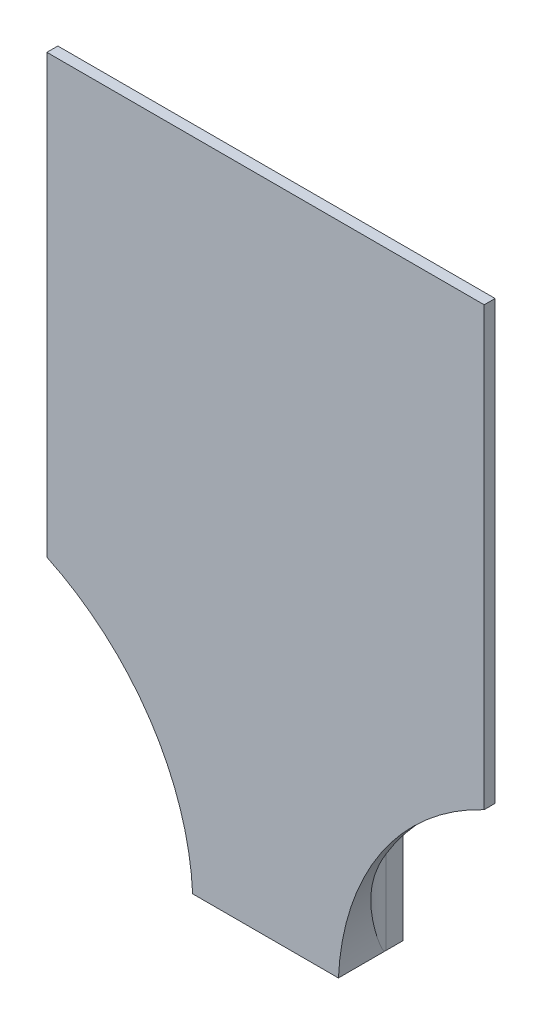
from build123d import *

# Parameters (mm, degrees)
SZKIC1_W                    = 40
SZKIC1_H                    = 20
DODANIE_WYCI_GNI_CIE1_DEPTH = 60
DODANIE_WYCI_GNI_CIE2_DEPTH = 120
DODANIE_WYCI_GNI_CIE3_DEPTH = 3
SZKIC4_W                    = 40
SZKIC4_H                    = 17
DODANIE_WYCI_GNI_CIE4_DEPTH = 120
WYTNIJ_WYCI_GNI_CIE1_DEPTH  = 40
SZKIC6_W                    = 34
SZKIC6_H                    = 170
WYTNIJ_WYCI_GNI_CIE2_DEPTH  = 17
ZAOKR_GLENIE1_R             = 10
SZKIC7_R                    = 2
WYTNIJ_WYCI_GNI_CIE3_DEPTH  = 10
SZKIC8_R                    = 5.5
WYTNIJ_WYCI_GNI_CIE4_DEPTH  = 6
ZAOKR_GLENIE2_R             = 2
WYTNIJ_WYCI_GNI_CIE5_DEPTH  = 191.000000132


with BuildPart() as part:
    # Szkic1 → Dodanie-wyciągnięcie1 (new body)
    with BuildSketch(Plane(origin=(0, 0, 0), x_dir=(1, 0, 0), z_dir=(0, 1, 0))):
        Rectangle(SZKIC1_W, SZKIC1_H)
    extrude(amount=DODANIE_WYCI_GNI_CIE1_DEPTH)

    # Szkic2 → Dodanie-wyciągnięcie2 (add)
    with BuildSketch(Plane(origin=(0, 60, 0), x_dir=(1, 0, 0), z_dir=(0, 1, 0))):
        Polygon((0, -10), (60, -10), (60, -7), (-60, -7), (-60, -10), align=None)
    extrude(amount=DODANIE_WYCI_GNI_CIE2_DEPTH)

    # Szkic3 → Dodanie-wyciągnięcie3 (add)
    with BuildSketch(Plane.XY.offset(10)):
        with BuildLine():
            Line((-60, 60), (-20, 60))
            Line((-20, 60), (-20, 0))
            ThreePointArc((-20, 0), (-31.679497057, 35.547001962), (-60, 60))
        make_face()
        with BuildLine():
            Line((60, 60), (20, 60))
            Line((20, 60), (20, 0))
            ThreePointArc((20, 0), (31.679497057, 35.547001962), (60, 60))
        make_face()
    extrude(amount=-DODANIE_WYCI_GNI_CIE3_DEPTH)

    # Szkic4 → Dodanie-wyciągnięcie4 (add)
    with BuildSketch(Plane(origin=(0, 60, 0), x_dir=(1, 0, 0), z_dir=(0, 1, 0))):
        with Locations((0, 1.5)):
            Rectangle(SZKIC4_W, SZKIC4_H)
    extrude(amount=DODANIE_WYCI_GNI_CIE4_DEPTH)

    # Szkic5 → Wytnij-wyciągnięcie1 (cut)
    with BuildSketch(Plane(origin=(20, 0, 0), x_dir=(0, 0, -1), z_dir=(1, 0, 0))):
        Polygon((-7, 180), (10, 10), (18.124176292, 10), (18.124176292, 180), align=None)
    extrude(amount=-WYTNIJ_WYCI_GNI_CIE1_DEPTH, mode=Mode.SUBTRACT)

    # Szkic6 → Wytnij-wyciągnięcie2 (cut)
    with BuildSketch(Plane(origin=(0, 0, -10), x_dir=(-1, 0, 0), z_dir=(0, 0, -1))):
        with Locations((0, 95)):
            Rectangle(SZKIC6_W, SZKIC6_H)
    extrude(amount=-WYTNIJ_WYCI_GNI_CIE2_DEPTH, mode=Mode.SUBTRACT)

    # Zaokrąglenie1
    # the kernel refuses this fillet: 10 mm, written as the material it adds along each edge
    with BuildSketch(Plane(origin=(-20, 0, 7), x_dir=(0, 0, -1), z_dir=(0, 1, 0))) as zaokr_glenie1_piece_1_section:
        with BuildLine():
            CenterArc((ZAOKR_GLENIE1_R, ZAOKR_GLENIE1_R), ZAOKR_GLENIE1_R, 180, 90)
            Line((0, ZAOKR_GLENIE1_R), (-ZAOKR_GLENIE1_R * 0.02, ZAOKR_GLENIE1_R))
            Line((-ZAOKR_GLENIE1_R * 0.02, ZAOKR_GLENIE1_R), (-ZAOKR_GLENIE1_R * 0.02, -ZAOKR_GLENIE1_R * 0.02))
            Line((-ZAOKR_GLENIE1_R * 0.02, -ZAOKR_GLENIE1_R * 0.02), (ZAOKR_GLENIE1_R, -ZAOKR_GLENIE1_R * 0.02))
            Line((ZAOKR_GLENIE1_R, -ZAOKR_GLENIE1_R * 0.02), (ZAOKR_GLENIE1_R, 0))
        make_face()
    zaokr_glenie1_piece_1 = extrude(amount=180, mode=Mode.PRIVATE)
    zaokr_glenie1_piece_1 = split(zaokr_glenie1_piece_1, bisect_by=Plane(origin=(-22.33425107, 87.013829457, -2.298617054), z_dir=(0, -0.09950371902099896, 0.9950371902099892)), keep=Keep.TOP, mode=Mode.PRIVATE)
    zaokr_glenie1_piece_1 = zaokr_glenie1_piece_1 - Plane(origin=(-89.92301766, -3.282011774, 4.977489049), x_dir=(0.9989002522895803, 0.04688588247876816, 0), z_dir=(0, 0, 1)) * Cylinder(70, 400, mode=Mode.PRIVATE)
    with BuildSketch(Plane(origin=(20, 180, 7), x_dir=(0, 0, -1), z_dir=(0, -1, 0))) as zaokr_glenie1_piece_2_section:
        with BuildLine():
            CenterArc((ZAOKR_GLENIE1_R, ZAOKR_GLENIE1_R), ZAOKR_GLENIE1_R, 180, 90)
            Line((0, ZAOKR_GLENIE1_R), (-ZAOKR_GLENIE1_R * 0.02, ZAOKR_GLENIE1_R))
            Line((-ZAOKR_GLENIE1_R * 0.02, ZAOKR_GLENIE1_R), (-ZAOKR_GLENIE1_R * 0.02, -ZAOKR_GLENIE1_R * 0.02))
            Line((-ZAOKR_GLENIE1_R * 0.02, -ZAOKR_GLENIE1_R * 0.02), (ZAOKR_GLENIE1_R, -ZAOKR_GLENIE1_R * 0.02))
            Line((ZAOKR_GLENIE1_R, -ZAOKR_GLENIE1_R * 0.02), (ZAOKR_GLENIE1_R, 0))
        make_face()
    zaokr_glenie1_piece_2 = extrude(amount=180, mode=Mode.PRIVATE)
    zaokr_glenie1_piece_2 = split(zaokr_glenie1_piece_2, bisect_by=Plane(origin=(22.33425107, 87.013829456, -2.298617054), z_dir=(0, -0.09950371902099896, 0.9950371902099892)), keep=Keep.TOP, mode=Mode.PRIVATE)
    zaokr_glenie1_piece_2 = zaokr_glenie1_piece_2 - Plane(origin=(89.92301766, -3.282011774, 4.977489049), x_dir=(-0.9989002522895803, 0.046885882478767064, 0), z_dir=(0, 0, 1)) * Cylinder(70, 400, mode=Mode.PRIVATE)
    with BuildSketch(Plane(origin=(-17, 180, 7), x_dir=(0, 0, -1), z_dir=(0, -1, 0))) as zaokr_glenie1_piece_3_section:
        with BuildLine():
            CenterArc((ZAOKR_GLENIE1_R, ZAOKR_GLENIE1_R), ZAOKR_GLENIE1_R, 180, 90)
            Line((0, ZAOKR_GLENIE1_R), (-ZAOKR_GLENIE1_R * 0.02, ZAOKR_GLENIE1_R))
            Line((-ZAOKR_GLENIE1_R * 0.02, ZAOKR_GLENIE1_R), (-ZAOKR_GLENIE1_R * 0.02, -ZAOKR_GLENIE1_R * 0.02))
            Line((-ZAOKR_GLENIE1_R * 0.02, -ZAOKR_GLENIE1_R * 0.02), (ZAOKR_GLENIE1_R, -ZAOKR_GLENIE1_R * 0.02))
            Line((ZAOKR_GLENIE1_R, -ZAOKR_GLENIE1_R * 0.02), (ZAOKR_GLENIE1_R, 0))
        make_face()
    zaokr_glenie1_piece_3 = extrude(amount=170, mode=Mode.PRIVATE)
    zaokr_glenie1_piece_3 = split(zaokr_glenie1_piece_3, bisect_by=Plane(origin=(-14.551056072, 85.950912881, -2.404908712), z_dir=(0, -0.09950371902099896, 0.9950371902099892)), keep=Keep.TOP, mode=Mode.PRIVATE)
    with BuildSketch(Plane(origin=(17, 10, 7), x_dir=(0, 0, -1), z_dir=(0, 1, 0))) as zaokr_glenie1_piece_4_section:
        with BuildLine():
            CenterArc((ZAOKR_GLENIE1_R, ZAOKR_GLENIE1_R), ZAOKR_GLENIE1_R, 180, 90)
            Line((0, ZAOKR_GLENIE1_R), (-ZAOKR_GLENIE1_R * 0.02, ZAOKR_GLENIE1_R))
            Line((-ZAOKR_GLENIE1_R * 0.02, ZAOKR_GLENIE1_R), (-ZAOKR_GLENIE1_R * 0.02, -ZAOKR_GLENIE1_R * 0.02))
            Line((-ZAOKR_GLENIE1_R * 0.02, -ZAOKR_GLENIE1_R * 0.02), (ZAOKR_GLENIE1_R, -ZAOKR_GLENIE1_R * 0.02))
            Line((ZAOKR_GLENIE1_R, -ZAOKR_GLENIE1_R * 0.02), (ZAOKR_GLENIE1_R, 0))
        make_face()
    zaokr_glenie1_piece_4 = extrude(amount=170, mode=Mode.PRIVATE)
    zaokr_glenie1_piece_4 = split(zaokr_glenie1_piece_4, bisect_by=Plane(origin=(14.551056072, 85.950912881, -2.404908712), z_dir=(0, -0.09950371902099896, 0.9950371902099892)), keep=Keep.TOP, mode=Mode.PRIVATE)
    add([zaokr_glenie1_piece_1, zaokr_glenie1_piece_2, zaokr_glenie1_piece_3, zaokr_glenie1_piece_4])

    # Szkic7 → Wytnij-wyciągnięcie3 (cut)
    with BuildSketch(Plane.XZ):
        with Locations(Location((-10, 0, 0), (0, 0, 270))):
            Circle(SZKIC7_R)
        with Locations(Location((10, 0, 0), (0, 0, 270))):
            Circle(SZKIC7_R)
    extrude(amount=-WYTNIJ_WYCI_GNI_CIE3_DEPTH, mode=Mode.SUBTRACT)

    # Szkic8 → Wytnij-wyciągnięcie4 (cut)
    with BuildSketch(Plane.XZ):
        with Locations(Location((-10, 0, 0), (0, 0, 270))):
            Circle(SZKIC8_R)
        with Locations(Location((10, 0, 0), (0, 0, 270))):
            Circle(SZKIC8_R)
    extrude(amount=-WYTNIJ_WYCI_GNI_CIE4_DEPTH, mode=Mode.SUBTRACT)

    # Zaokrąglenie2
    zaokr_glenie2_edges = [part.edges().sort_by_distance(p)[0] for p in [
        (-10, 0, 5.5),
        (-10, 6, 5.5),
        (10, 0, 5.5),
        (10, 6, 5.5),
    ]]
    fillet(zaokr_glenie2_edges, radius=ZAOKR_GLENIE2_R)

    # Szkic9 → Wytnij-wyciągnięcie5 (cut, through all)
    with BuildSketch(Plane.XZ):
        with BuildLine():
            Line((7.5, -10), (-7.5, -10))
            ThreePointArc((-7.5, -10), (-20.893920133, -7.335783638), (-32.248737342, 0.251262658))
            Line((-32.248737342, 0.251262658), (-32.248737342, -13.02318051))
            Line((-32.248737342, -13.02318051), (32.248737342, -13.02318051))
            Line((32.248737342, -13.02318051), (32.248737342, 0.251262658))
            ThreePointArc((32.248737342, 0.251262658), (20.893920133, -7.335783638), (7.5, -10))
        make_face()
    extrude(amount=-WYTNIJ_WYCI_GNI_CIE5_DEPTH, mode=Mode.SUBTRACT)


solid = part.part
